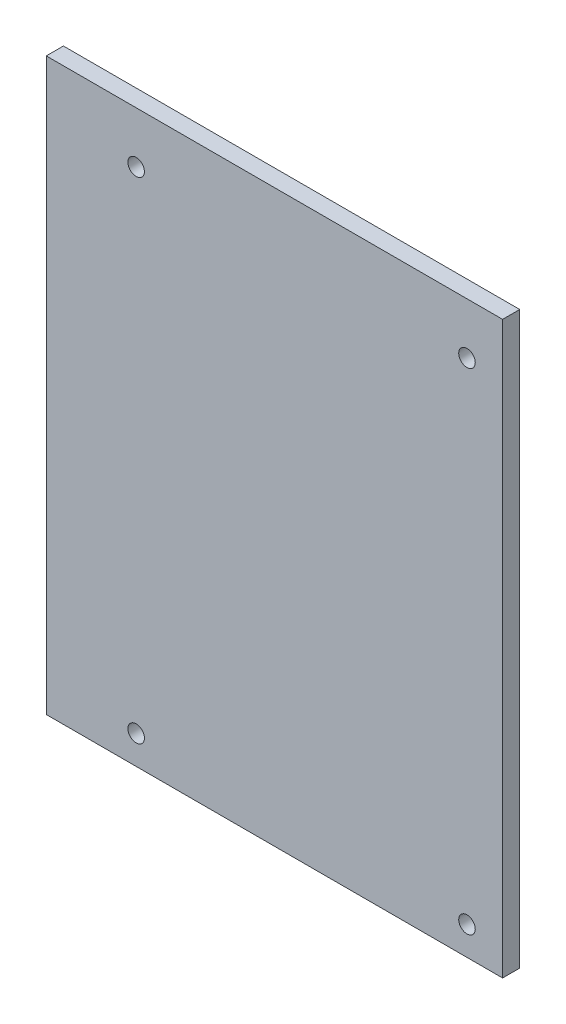
from build123d import *

# Parameters (mm, degrees)
SKETCH1_W           = 80
SKETCH1_H           = 100
SKETCH1_R           = 1.45
BOSS_EXTRUDE1_DEPTH = 3


with BuildPart() as part:
    # Sketch1 → Boss-Extrude1 (new body)
    with BuildSketch(Plane.XY):
        with Locations((4.781147096, 4.031059311)):
            Rectangle(SKETCH1_W, SKETCH1_H)
        with Locations((38.536746358, -40.952272815)):
            Circle(SKETCH1_R, mode=Mode.SUBTRACT)
        with Locations((38.536746358, 45.047727185)):
            Circle(SKETCH1_R, mode=Mode.SUBTRACT)
        with Locations((-19.463253642, -40.952272815)):
            Circle(SKETCH1_R, mode=Mode.SUBTRACT)
        with Locations((-19.463253642, 45.047727185)):
            Circle(SKETCH1_R, mode=Mode.SUBTRACT)
    extrude(amount=BOSS_EXTRUDE1_DEPTH)


solid = part.part
